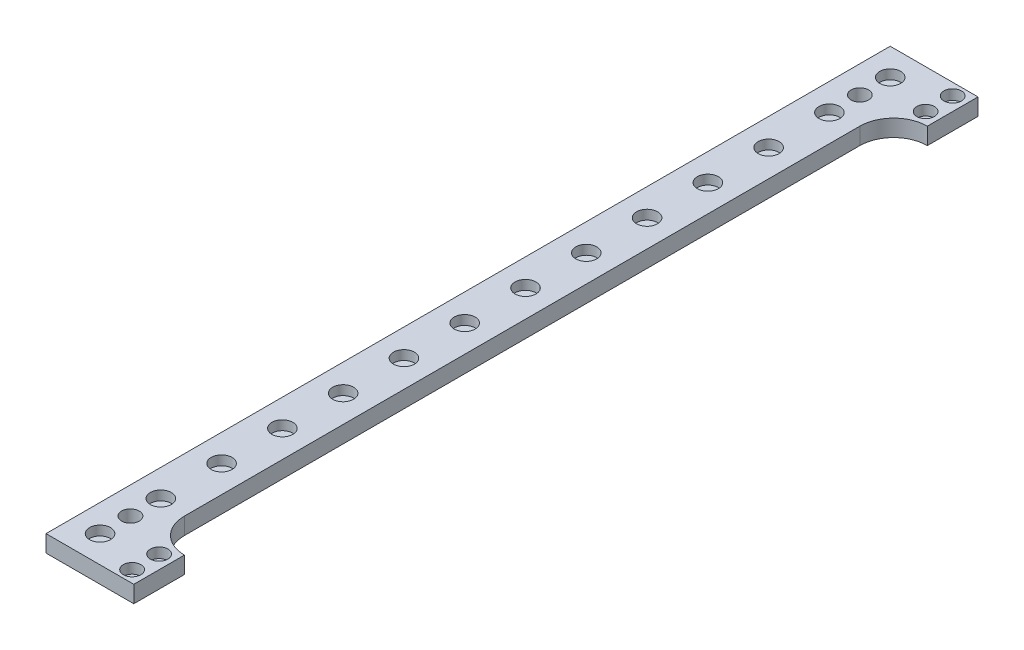
from build123d import *

# Parameters (mm, degrees)
SKETCH1_W           = 16
SKETCH1_H           = 250
BOSS_EXTRUDE1_DEPTH = 5
SKETCH2_R           = 3.1
CUT_EXTRUDE1_DEPTH  = 2.8
SKETCH4_W           = 10
SKETCH4_H           = 15
BOSS_EXTRUDE2_DEPTH = 5
CUT_EXTRUDE2_REACH  = 253.398
SKETCH5_R           = 1.65
SKETCH6_R           = 2.6
CUT_EXTRUDE3_DEPTH  = 3
FILLET1_R           = 10
SKETCH8_R           = 2.6
CUT_EXTRUDE4_DEPTH  = 4


with BuildPart() as part:
    # Sketch1 → Boss-Extrude1 (new body)
    with BuildSketch(Plane(origin=(0, 0, 0), x_dir=(1, 0, 0), z_dir=(0, 1, 0))):
        with Locations((8, 125)):
            Rectangle(SKETCH1_W, SKETCH1_H)
    extrude(amount=BOSS_EXTRUDE1_DEPTH)

    # Sketch2 → Cut-Extrude1 (cut)
    with BuildSketch(Plane(origin=(0, 5, 0), x_dir=(1, 0, 0), z_dir=(0, 1, 0))):
        with Locations(Location((8, 242, 0), (0, 0, 270))):
            Circle(SKETCH2_R)
        with Locations(Location((8, 224, 0), (0, 0, 270))):
            Circle(SKETCH2_R)
        with Locations(Location((8, 206, 0), (0, 0, 270))):
            Circle(SKETCH2_R)
        with Locations(Location((8, 188, 0), (0, 0, 270))):
            Circle(SKETCH2_R)
        with Locations(Location((8, 170, 0), (0, 0, 270))):
            Circle(SKETCH2_R)
        with Locations(Location((8, 152, 0), (0, 0, 270))):
            Circle(SKETCH2_R)
        with Locations(Location((8, 134, 0), (0, 0, 270))):
            Circle(SKETCH2_R)
        with Locations(Location((8, 116, 0), (0, 0, 270))):
            Circle(SKETCH2_R)
        with Locations(Location((8, 98, 0), (0, 0, 270))):
            Circle(SKETCH2_R)
        with Locations(Location((8, 80, 0), (0, 0, 270))):
            Circle(SKETCH2_R)
        with Locations(Location((8, 62, 0), (0, 0, 270))):
            Circle(SKETCH2_R)
        with Locations(Location((8, 44, 0), (0, 0, 270))):
            Circle(SKETCH2_R)
        with Locations(Location((8, 26, 0), (0, 0, 270))):
            Circle(SKETCH2_R)
        with Locations(Location((8, 8, 0), (0, 0, 270))):
            Circle(SKETCH2_R)
    extrude(amount=-CUT_EXTRUDE1_DEPTH, mode=Mode.SUBTRACT)

    # Sketch4 → Boss-Extrude2 (add)
    with BuildSketch(Plane(origin=(0, 5, 0), x_dir=(1, 0, 0), z_dir=(0, 1, 0))):
        with Locations((21, 7.5)):
            Rectangle(SKETCH4_W, SKETCH4_H)
        with Locations((21, 242.5)):
            Rectangle(SKETCH4_W, SKETCH4_H)
    extrude(amount=-BOSS_EXTRUDE2_DEPTH)

    # Sketch5 → Cut-Extrude2 (cut, up to next)
    with BuildSketch(Plane.XZ, mode=Mode.PRIVATE) as cut_extrude2_sk1:
        with Locations(Location((22, -3.5, 0), (0, 0, 270))):
            Circle(SKETCH5_R)
    cut_extrude2_tool1 = extrude(cut_extrude2_sk1.sketch, amount=-CUT_EXTRUDE2_REACH, mode=Mode.PRIVATE) & part.part
    # Sketch5 → Cut-Extrude2 (cut, up to next)
    with BuildSketch(Plane.XZ, mode=Mode.PRIVATE) as cut_extrude2_sk2:
        with Locations(Location((22, -11.5, 0), (0, 0, 270))):
            Circle(SKETCH5_R)
    cut_extrude2_tool2 = extrude(cut_extrude2_sk2.sketch, amount=-CUT_EXTRUDE2_REACH, mode=Mode.PRIVATE) & part.part
    # Sketch5 → Cut-Extrude2 (cut, up to next)
    with BuildSketch(Plane.XZ, mode=Mode.PRIVATE) as cut_extrude2_sk3:
        with Locations(Location((22, -238.5, 0), (0, 0, 270))):
            Circle(SKETCH5_R)
    cut_extrude2_tool3 = extrude(cut_extrude2_sk3.sketch, amount=-CUT_EXTRUDE2_REACH, mode=Mode.PRIVATE) & part.part
    # Sketch5 → Cut-Extrude2 (cut, up to next)
    with BuildSketch(Plane.XZ, mode=Mode.PRIVATE) as cut_extrude2_sk4:
        with Locations(Location((22, -246.5, 0), (0, 0, 270))):
            Circle(SKETCH5_R)
    cut_extrude2_tool4 = extrude(cut_extrude2_sk4.sketch, amount=-CUT_EXTRUDE2_REACH, mode=Mode.PRIVATE) & part.part
    # Sketch5 → Cut-Extrude2 (cut, up to next)
    with BuildSketch(Plane.XZ, mode=Mode.PRIVATE) as cut_extrude2_sk5:
        with Locations(Location((8, -17, 0), (0, 0, 270))):
            Circle(SKETCH5_R)
    cut_extrude2_tool5 = extrude(cut_extrude2_sk5.sketch, amount=-CUT_EXTRUDE2_REACH, mode=Mode.PRIVATE) & part.part
    # Sketch5 → Cut-Extrude2 (cut, up to next)
    with BuildSketch(Plane.XZ, mode=Mode.PRIVATE) as cut_extrude2_sk6:
        with Locations(Location((8, -233, 0), (0, 0, 270))):
            Circle(SKETCH5_R)
    cut_extrude2_tool6 = extrude(cut_extrude2_sk6.sketch, amount=-CUT_EXTRUDE2_REACH, mode=Mode.PRIVATE) & part.part
    add(cut_extrude2_tool1.solids().sort_by_distance((22, 0, -3.5))[0], mode=Mode.SUBTRACT)
    add(cut_extrude2_tool2.solids().sort_by_distance((22, 0, -11.5))[0], mode=Mode.SUBTRACT)
    add(cut_extrude2_tool3.solids().sort_by_distance((22, 0, -238.5))[0], mode=Mode.SUBTRACT)
    add(cut_extrude2_tool4.solids().sort_by_distance((22, 0, -246.5))[0], mode=Mode.SUBTRACT)
    add(cut_extrude2_tool5.solids().sort_by_distance((8, 0, -17))[0], mode=Mode.SUBTRACT)
    add(cut_extrude2_tool6.solids().sort_by_distance((8, 0, -233))[0], mode=Mode.SUBTRACT)

    # Sketch6 → Cut-Extrude3 (cut)
    with BuildSketch(Plane(origin=(0, 5, 0), x_dir=(1, 0, 0), z_dir=(0, 1, 0))):
        with Locations(Location((22, 246.5, 0), (0, 0, 270))):
            Circle(SKETCH6_R)
        with Locations(Location((22, 238.5, 0), (0, 0, 270))):
            Circle(SKETCH6_R)
        with Locations(Location((22, 11.5, 0), (0, 0, 270))):
            Circle(SKETCH6_R)
        with Locations(Location((22, 3.5, 0), (0, 0, 270))):
            Circle(SKETCH6_R)
        with Locations(Location((8, 233, 0), (0, 0, 270))):
            Circle(SKETCH6_R)
        with Locations(Location((8, 17, 0), (0, 0, 270))):
            Circle(SKETCH6_R)
    extrude(amount=-CUT_EXTRUDE3_DEPTH, mode=Mode.SUBTRACT)

    # Fillet1
    fillet1_edges = [part.edges().sort_by_distance(p)[0] for p in [
        (16, 2.5, -235),
        (16, 2.5, -15),
    ]]
    fillet(fillet1_edges, radius=FILLET1_R - 0.0001)  # a hair under: the kernel refuses the full size

    # Sketch8 → Cut-Extrude4 (cut)
    with BuildSketch(Plane(origin=(0, 5, 0), x_dir=(1, 0, 0), z_dir=(0, 1, 0))):
        with Locations(Location((8, 233, 0), (0, 0, 270))):
            Circle(SKETCH8_R)
        with Locations(Location((8, 17, 0), (0, 0, 270))):
            Circle(SKETCH8_R)
    extrude(amount=-CUT_EXTRUDE4_DEPTH, mode=Mode.SUBTRACT)


solid = part.part
